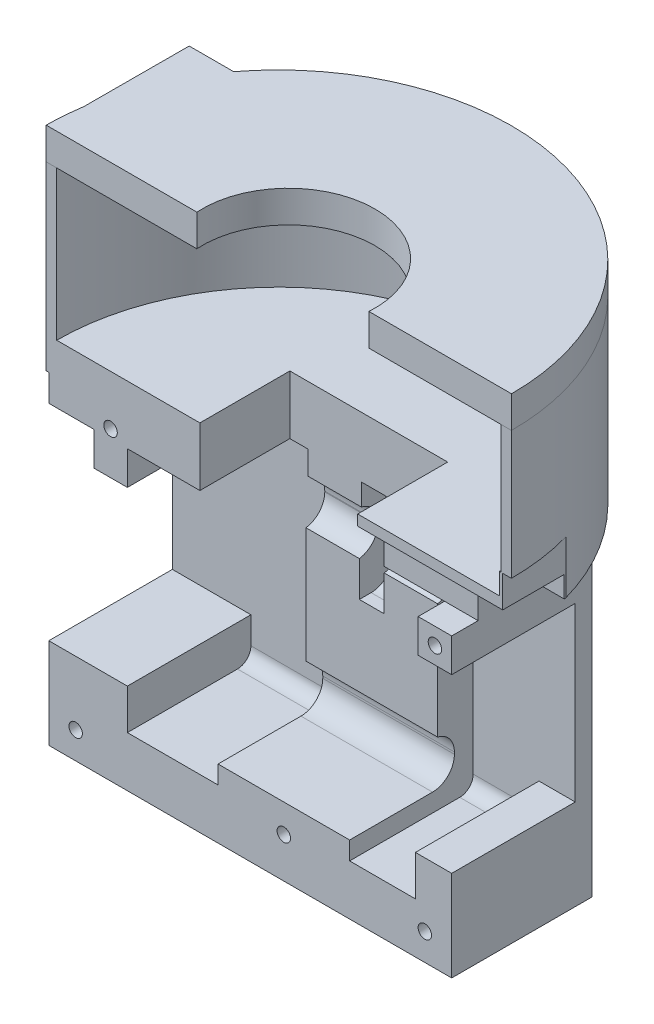
from build123d import *

# Parameters (mm, degrees)
BOSS_EXTRUDE4_START        = -101.558494002
BOSS_EXTRUDE4_OUTLINE_R    = 1.27
BOSS_EXTRUDE4_DEPTH        = 26.543
BOSS_EXTRUDE4_2_DEPTH      = 3.175
BOSS_EXTRUDE4_START_2      = -98.383494002
BOSS_EXTRUDE4_3_OUTLINE_W  = 4.699
BOSS_EXTRUDE4_3_OUTLINE_H  = 19.05
BOSS_EXTRUDE4_3_DEPTH      = 3.175
BOSS_EXTRUDE4_START_3      = -86.941966379
BOSS_EXTRUDE4_4_OUTLINE_W  = 27.430295146
BOSS_EXTRUDE4_4_OUTLINE_H  = 6
BOSS_EXTRUDE4_4_DEPTH      = 6.926472377
BOSS_EXTRUDE4_START_4      = -95.208494002
BOSS_EXTRUDE4_5_OUTLINE_W  = 29.845
BOSS_EXTRUDE4_5_OUTLINE_H  = 6
BOSS_EXTRUDE4_5_DEPTH      = 3.175
BOSS_EXTRUDE4_6_OUTLINE_W  = 4.699
BOSS_EXTRUDE4_6_OUTLINE_H  = 19.05
BOSS_EXTRUDE4_6_DEPTH      = 0.381
BOSS_EXTRUDE4_START_5      = -44.196
BOSS_EXTRUDE4_7_DEPTH      = 24.892
BOSS_EXTRUDE4_8_DEPTH      = 10.0965
BOSS_EXTRUDE4_START_6      = -29.4005
BOSS_EXTRUDE4_9_DEPTH      = 10.0965
BOSS_EXTRUDE4_START_7      = -62
BOSS_EXTRUDE4_10_OUTLINE_W = 5.08
BOSS_EXTRUDE4_10_OUTLINE_H = 3.175
BOSS_EXTRUDE4_10_DEPTH     = 56
BOSS_EXTRUDE4_START_8      = 61.1124
BOSS_EXTRUDE4_11_DEPTH     = 6
BOSS_EXTRUDE4_START_9      = 56.0324
BOSS_EXTRUDE4_12_OUTLINE_W = 29.845
BOSS_EXTRUDE4_12_OUTLINE_H = 3.175
BOSS_EXTRUDE4_12_DEPTH     = 5.08
BOSS_EXTRUDE4_START_10     = 55.687225257
BOSS_EXTRUDE4_13_OUTLINE_W = 24.892
BOSS_EXTRUDE4_13_OUTLINE_H = 3.175
BOSS_EXTRUDE4_13_DEPTH     = 1.422815543
BOSS_EXTRUDE5_DEPTH        = 4
INDENT2_START              = 61.1124
INDENT2_DEPTH              = 4
CUT_EXTRUDE1_DEPTH         = 5
BOSS_EXTRUDE6_DEPTH        = 21.543
SKETCH18_W                 = 6.35
SKETCH18_H                 = 6.35
BOSS_EXTRUDE7_DEPTH        = 5
SKETCH19_R                 = 1.27
CUT_EXTRUDE2_DEPTH         = 26.543
SKETCH20_R                 = 42
CUT_EXTRUDE3_DEPTH         = 4
BOSS_EXTRUDE9_DEPTH        = 5
BOSS_EXTRUDE10_DEPTH       = 24.225897016
BOSS_EXTRUDE10_START       = 95.499839318
BOSS_EXTRUDE10_2_OUTLINE_W = 91
BOSS_EXTRUDE10_2_OUTLINE_H = 47
BOSS_EXTRUDE10_2_DEPTH     = 1.500160682
BOSS_EXTRUDE11_DEPTH       = 6


with BuildPart() as part:
    # Boss-Extrude4: read off the stored shape, not the designer's step
    # Boss-Extrude4 outline → Boss-Extrude4 (new body)
    # profile 1 of 3: a face of its own
    with BuildSketch(Plane.XY.offset(BOSS_EXTRUDE4_START)):
        Polygon((0, 61.1124), (-17.78, 61.1124), (-17.78, 56.0324), (-6.35, 56.0324), (-6.35, 49.6824), (0, 49.6824), align=None)
        with Locations((-3.81, 58.5724)):
            Circle(BOSS_EXTRUDE4_OUTLINE_R, mode=Mode.SUBTRACT)
    # profile 2 of 3: a face of its own
    with BuildSketch(Plane.XY.offset(BOSS_EXTRUDE4_START)):
        Polygon((-47.625, 56.0324), (-47.625, 61.1124), (-47.625, 67.1124), (-76.2, 67.1124), (-76.2, 56.0324), (-67.691, 56.0324), (-67.691, 49.6824), (-61.341, 49.6824), (-61.341, 56.0324), align=None)
        with Locations((-64.516, 57.6834)):
            Circle(BOSS_EXTRUDE4_OUTLINE_R, mode=Mode.SUBTRACT)
    # profile 3 of 3: a face of its own
    with BuildSketch(Plane.XY.offset(BOSS_EXTRUDE4_START)):
        Polygon((0, 0), (0, 17.145), (-6.858, 17.145), (-6.858, 9.525), (-19.304, 9.525), (-19.304, 12.954), (-44.196, 12.954), (-44.196, 9.525), (-61.341, 9.525), (-61.341, 17.145), (-76.2, 17.145), (-76.2, 0), align=None)
        with Locations((-71.12, 5.08)):
            Circle(BOSS_EXTRUDE4_OUTLINE_R, mode=Mode.SUBTRACT)
        with Locations((-31.75, 7.62)):
            Circle(BOSS_EXTRUDE4_OUTLINE_R, mode=Mode.SUBTRACT)
        with Locations((-5.08, 5.08)):
            Circle(BOSS_EXTRUDE4_OUTLINE_R, mode=Mode.SUBTRACT)
    extrude(amount=BOSS_EXTRUDE4_DEPTH)

    # Boss-Extrude4 2 outline → Boss-Extrude4 2 (add)
    with BuildSketch(Plane.XY.offset(BOSS_EXTRUDE4_START)):
        Polygon((-47.625, 67.1124), (-47.625, 56.0324), (-61.341, 56.0324), (-61.341, 49.6824), (-67.691, 49.6824), (-67.691, 56.0324), (-76.2, 56.0324), (-76.2, 17.145), (-61.341, 17.145), (-61.341, 9.525), (-44.196, 9.525), (-44.196, 12.954), (-19.304, 12.954), (-19.304, 9.525), (-6.858, 9.525), (-6.858, 17.145), (0, 17.145), (0, 49.6824), (-6.35, 49.6824), (-6.35, 56.0324), (-17.78, 56.0324), (-17.78, 67.1124), align=None)
    extrude(amount=BOSS_EXTRUDE4_2_DEPTH)

    # Boss-Extrude4 3 outline → Boss-Extrude4 3 (add)
    with BuildSketch(Plane.XY.offset(BOSS_EXTRUDE4_START_2)):
        Polygon((-47.625, 67.1124), (-47.625, 56.0324), (-44.196, 56.0324), (-44.196, 12.954), (-19.304, 12.954), (-19.304, 56.0324), (-17.78, 56.0324), (-17.78, 67.1124), align=None)
        with Locations((-31.75, 46.162225257)):
            Rectangle(BOSS_EXTRUDE4_3_OUTLINE_W, BOSS_EXTRUDE4_3_OUTLINE_H, mode=Mode.SUBTRACT)
    extrude(amount=BOSS_EXTRUDE4_3_DEPTH)

    # Boss-Extrude4 4 outline → Boss-Extrude4 4 (add)
    with BuildSketch(Plane.XY.offset(BOSS_EXTRUDE4_START_3)):
        with Locations((-4.064852427, 64.1124)):
            Rectangle(BOSS_EXTRUDE4_4_OUTLINE_W, BOSS_EXTRUDE4_4_OUTLINE_H)
    extrude(amount=BOSS_EXTRUDE4_4_DEPTH)

    # Boss-Extrude4 5 outline → Boss-Extrude4 5 (add)
    with BuildSketch(Plane.XY.offset(BOSS_EXTRUDE4_START_4)):
        with Locations((-32.7025, 64.1124)):
            Rectangle(BOSS_EXTRUDE4_5_OUTLINE_W, BOSS_EXTRUDE4_5_OUTLINE_H)
    extrude(amount=BOSS_EXTRUDE4_5_DEPTH)

    # Boss-Extrude4 6 outline → Boss-Extrude4 6 (add)
    with BuildSketch(Plane.XY.offset(BOSS_EXTRUDE4_START_2)):
        with Locations((-31.75, 46.162225257)):
            Rectangle(BOSS_EXTRUDE4_6_OUTLINE_W, BOSS_EXTRUDE4_6_OUTLINE_H)
    extrude(amount=BOSS_EXTRUDE4_6_DEPTH)

    # Boss-Extrude4 7 outline → Boss-Extrude4 7 (add)
    with BuildSketch(Plane.YZ.offset(BOSS_EXTRUDE4_START_5)):
        with BuildLine():
            Line((55.687225257, -92.033494002), (55.687225257, -93.874994002))
            ThreePointArc((55.687225257, -93.874994002), (54.478308496, -96.793577242), (51.559725257, -98.002494002))
            Line((51.559725257, -98.002494002), (55.687225257, -98.002494002))
            Line((55.687225257, -98.002494002), (55.687225257, -95.208494002))
            Line((55.687225257, -95.208494002), (61.1124, -95.208494002))
            Line((61.1124, -95.208494002), (61.1124, -92.033494002))
            Line((61.1124, -92.033494002), (55.687225257, -92.033494002))
        make_face()
        with BuildLine():
            Line((12.954, -95.208494002), (36.637225257, -95.208494002))
            Line((36.637225257, -95.208494002), (36.637225257, -98.002494002))
            Line((36.637225257, -98.002494002), (40.764725257, -98.002494002))
            ThreePointArc((40.764725257, -98.002494002), (37.846142018, -96.793577242), (36.637225257, -93.874994002))
            Line((36.637225257, -93.874994002), (36.637225257, -91.652494002))
            Line((36.637225257, -91.652494002), (21.4884, -91.652494002))
            ThreePointArc((21.4884, -91.652494002), (20.032074207, -93.937871393), (17.472307372, -94.827494002))
            Line((17.472307372, -94.827494002), (17.0815, -94.827494002))
            ThreePointArc((17.0815, -94.827494002), (14.16291676, -93.618577241), (12.954, -90.699994002))
            Line((12.954, -90.699994002), (12.954, -95.208494002))
        make_face()
    extrude(amount=BOSS_EXTRUDE4_7_DEPTH)

    # Boss-Extrude4 8 outline → Boss-Extrude4 8 (add)
    with BuildSketch(Plane.YZ.offset(BOSS_EXTRUDE4_START_5)):
        with BuildLine():
            Line((55.687225257, -92.033494002), (51.5874, -92.033494002))
            ThreePointArc((51.5874, -92.033494002), (50.131074207, -94.318871393), (47.571307372, -95.208494002))
            Line((47.571307372, -95.208494002), (55.465878608, -95.208494002))
            ThreePointArc((55.465878608, -95.208494002), (55.631512592, -94.55086688), (55.687225257, -93.874994002))
            Line((55.687225257, -93.874994002), (55.687225257, -92.033494002))
        make_face()
        with BuildLine():
            Line((36.858571906, -95.208494002), (47.420143143, -95.208494002))
            ThreePointArc((47.420143143, -95.208494002), (44.711140559, -94.19508476), (43.3324, -91.652494002))
            Line((43.3324, -91.652494002), (36.637225257, -91.652494002))
            Line((36.637225257, -91.652494002), (36.637225257, -93.874994002))
            ThreePointArc((36.637225257, -93.874994002), (36.692937922, -94.55086688), (36.858571906, -95.208494002))
        make_face()
    extrude(amount=BOSS_EXTRUDE4_8_DEPTH)

    # Boss-Extrude4 9 outline → Boss-Extrude4 9 (add)
    with BuildSketch(Plane.YZ.offset(BOSS_EXTRUDE4_START_6)):
        with BuildLine():
            Line((55.687225257, -92.033494002), (51.5874, -92.033494002))
            ThreePointArc((51.5874, -92.033494002), (50.131074207, -94.318871393), (47.571307372, -95.208494002))
            Line((47.571307372, -95.208494002), (55.465878608, -95.208494002))
            ThreePointArc((55.465878608, -95.208494002), (55.631512592, -94.55086688), (55.687225257, -93.874994002))
            Line((55.687225257, -93.874994002), (55.687225257, -92.033494002))
        make_face()
        with BuildLine():
            Line((36.858571906, -95.208494002), (47.420143143, -95.208494002))
            ThreePointArc((47.420143143, -95.208494002), (44.711140559, -94.19508476), (43.3324, -91.652494002))
            Line((43.3324, -91.652494002), (36.637225257, -91.652494002))
            Line((36.637225257, -91.652494002), (36.637225257, -93.874994002))
            ThreePointArc((36.637225257, -93.874994002), (36.692937922, -94.55086688), (36.858571906, -95.208494002))
        make_face()
    extrude(amount=BOSS_EXTRUDE4_9_DEPTH)

    # Boss-Extrude4 10 outline → Boss-Extrude4 10 (add)
    with BuildSketch(Plane.YZ.offset(BOSS_EXTRUDE4_START_7)):
        with Locations((58.5724, -93.620994002)):
            Rectangle(BOSS_EXTRUDE4_10_OUTLINE_W, BOSS_EXTRUDE4_10_OUTLINE_H)
        with BuildLine():
            Line((9.525, -98.383494002), (12.065, -98.383494002))
            ThreePointArc((12.065, -98.383494002), (10.268948776, -97.639545226), (9.525, -95.843494002))
            Line((9.525, -95.843494002), (9.525, -98.383494002))
        make_face()
    extrude(amount=BOSS_EXTRUDE4_10_DEPTH)

    # Boss-Extrude4 11 outline → Boss-Extrude4 11 (add)
    with BuildSketch(Plane(origin=(0, 0, 0), x_dir=(1, 0, 0), z_dir=(0, 1, 0)).offset(BOSS_EXTRUDE4_START_8)):
        with BuildLine():
            ThreePointArc((-76.2, 81.646292879), (-76.576695149, 78.340400016), (-76.7025, 75.015494002))
            Line((-76.7025, 75.015494002), (-76.2, 75.015494002))
            Line((-76.2, 75.015494002), (-76.2, 81.646292879))
        make_face()
        with BuildLine():
            ThreePointArc((9.650295146, 86.941966379), (-24.542264928, 118.252174767), (-67.794794753, 101.558494002))
            Line((-67.794794753, 101.558494002), (-17.78, 101.558494002))
            Line((-17.78, 101.558494002), (-17.78, 86.941966379))
            Line((-17.78, 86.941966379), (9.650295146, 86.941966379))
        make_face()
    extrude(amount=BOSS_EXTRUDE4_11_DEPTH)

    # Boss-Extrude4 12 outline → Boss-Extrude4 12 (add)
    with BuildSketch(Plane(origin=(0, 0, 0), x_dir=(1, 0, 0), z_dir=(0, 1, 0)).offset(BOSS_EXTRUDE4_START_9)):
        with Locations((-32.7025, 93.620994002)):
            Rectangle(BOSS_EXTRUDE4_12_OUTLINE_W, BOSS_EXTRUDE4_12_OUTLINE_H)
    extrude(amount=BOSS_EXTRUDE4_12_DEPTH)

    # Boss-Extrude4 13 outline → Boss-Extrude4 13 (add)
    with BuildSketch(Plane(origin=(0, 0, 0), x_dir=(1, 0, 0), z_dir=(0, 1, 0)).offset(BOSS_EXTRUDE4_START_10)):
        with Locations((-31.75, 93.620994002)):
            Rectangle(BOSS_EXTRUDE4_13_OUTLINE_W, BOSS_EXTRUDE4_13_OUTLINE_H)
    extrude(amount=BOSS_EXTRUDE4_13_DEPTH)

    # Sketch11 → Boss-Extrude5 (add)
    with BuildSketch(Plane(origin=(0, 67.1124, 0), x_dir=(1, 0, 0), z_dir=(0, 1, 0))):
        with BuildLine():
            Line((-17.78, 80.015494002), (9.650295146, 80.015494002))
            Line((9.650295146, 80.015494002), (9.650295146, 86.941966379))
            ThreePointArc((9.650295146, 86.941966379), (-24.542264928, 118.252174767), (-67.794794753, 101.558494002))
            Line((-67.794794753, 101.558494002), (-76.2, 101.558494002))
            Line((-76.2, 101.558494002), (-76.2, 81.646292879))
            ThreePointArc((-76.2, 81.646292879), (-76.576695149, 78.340400016), (-76.7025, 75.015494002))
            Line((-76.7025, 75.015494002), (-47.625, 75.015494002))
            Line((-47.625, 75.015494002), (-47.625, 92.033494002))
            Line((-47.625, 92.033494002), (-17.78, 92.033494002))
            Line((-17.78, 92.033494002), (-17.78, 80.015494002))
        make_face()
    extrude(amount=BOSS_EXTRUDE5_DEPTH)

    # Indent2: read off the stored shape, not the designer's step
    # Indent2 outline → Indent2 (cut)
    with BuildSketch(Plane(origin=(0, 0, 0), x_dir=(1, 0, 0), z_dir=(0, 1, 0)).offset(INDENT2_START)):
        Polygon((-9.889050862, 86.629325085), (-17.78, 86.629325085), (-17.78, 80.015494002), (9.650295146, 80.015494002), (9.650295146, 86.629325085), (0.110949138, 86.629325085), (0.110949138, 90.629325085), (-9.889050862, 90.629325085), align=None)
    extrude(amount=INDENT2_DEPTH, mode=Mode.SUBTRACT)

    # Sketch16 → Cut-Extrude1 (cut)
    with BuildSketch(Plane.XY.offset(-75.015494002)):
        Polygon((0, 61.1124), (-17.78, 61.1124), (-17.78, 56.0324), (-6.35, 56.0324), (-6.35, 49.6824), (0, 49.6824), align=None)
    extrude(amount=-CUT_EXTRUDE1_DEPTH, mode=Mode.SUBTRACT)

    # Sketch17 → Boss-Extrude6 (add)
    with BuildSketch(Plane.XY.offset(-80.015494002)):
        Polygon((0, 49.6824), (0, 61.1124), (-17.78, 61.1124), (-17.78, 56.0324), (-6.35, 56.0324), (-6.35, 49.6824), align=None)
    extrude(amount=-BOSS_EXTRUDE6_DEPTH)

    # Sketch18 → Boss-Extrude7 (add)
    with BuildSketch(Plane.XY.offset(-80.015494002)):
        with Locations((-3.175, 52.8574)):
            Rectangle(SKETCH18_W, SKETCH18_H)
    extrude(amount=BOSS_EXTRUDE7_DEPTH)

    # Sketch19 → Cut-Extrude2 (cut)
    with BuildSketch(Plane.XY.offset(-75.015494002)):
        with Locations((-3.175, 52.8574)):
            Circle(SKETCH19_R)
    extrude(amount=-CUT_EXTRUDE2_DEPTH, mode=Mode.SUBTRACT)

    # Sketch20 → Cut-Extrude3 (cut)
    with BuildSketch(Plane(origin=(0, 71.1124, 0), x_dir=(1, 0, 0), z_dir=(0, 1, 0))):
        with Locations((-32.7025, 75.015494002)):
            Circle(SKETCH20_R)
    extrude(amount=-CUT_EXTRUDE3_DEPTH, mode=Mode.SUBTRACT)

    # Sketch23 → Boss-Extrude9 (add)
    with BuildSketch(Plane.XY.offset(-80.015494002)):
        Polygon((9.650295146, 71.1124), (8.998818924, 71.1124), (8.998818924, 67.1124), (-17.78, 67.1124), (-17.78, 65.1124), (9.650295146, 65.1124), align=None)
    extrude(amount=BOSS_EXTRUDE9_DEPTH)

    # Boss-Extrude10: read off the stored shape, not the designer's step
    # Boss-Extrude10 outline → Boss-Extrude10 (add)
    with BuildSketch(Plane(origin=(0, 71.1124, 0), x_dir=(1, 0, 0), z_dir=(0, 1, 0))):
        with BuildLine():
            ThreePointArc((-74.7025, 75.015494002), (-46.790110082, 114.582389788), (-0.153012277, 101.558494002))
            ThreePointArc((-0.153012277, 101.558494002), (6.864395786, 89.103104084), (9.2975, 75.015494002))
            Line((9.2975, 75.015494002), (11.2975, 75.015494002))
            ThreePointArc((11.2975, 75.015494002), (-18.703588777, 116.729166635), (-67.794794753, 101.558494002))
            Line((-67.794794753, 101.558494002), (-76.2, 101.558494002))
            Line((-76.2, 101.558494002), (-76.2, 81.646292879))
            ThreePointArc((-76.2, 81.646292879), (-76.576695149, 78.340400016), (-76.7025, 75.015494002))
            Line((-76.7025, 75.015494002), (-74.7025, 75.015494002))
        make_face()
    extrude(amount=BOSS_EXTRUDE10_DEPTH)

    # Boss-Extrude10 2 outline → Boss-Extrude10 2 (cut)
    with BuildSketch(Plane(origin=(0, 0, 0), x_dir=(1, 0, 0), z_dir=(0, 0.9999976749508124, -0.0021564074219559007)).offset(BOSS_EXTRUDE10_START)):
        with Locations((-32.5, 96.5)):
            Rectangle(BOSS_EXTRUDE10_2_OUTLINE_W, BOSS_EXTRUDE10_2_OUTLINE_H)
    extrude(amount=BOSS_EXTRUDE10_2_DEPTH, mode=Mode.SUBTRACT)

    # Sketch26 → Boss-Extrude11 (add)
    with BuildSketch(Plane(origin=(0, 95.499617276, -0.205936562), x_dir=(1, 0, 0), z_dir=(0, 0.9999976749508124, -0.002156407421956261))):
        with BuildLine():
            Line((11.2975, 74.809731376), (-15.671546302, 74.809731376))
            ThreePointArc((-15.671546302, 74.809731376), (-31.94102841, 92.21425616), (-48.210510518, 74.809731376))
            Line((-48.210510518, 74.809731376), (-76.7025, 74.809731376))
            add(Edge.make_bspline(
                [(-76.2, 81.44054567), (-76.7025, 78.144178977), (-76.7025, 74.809731376)],
                knots=[1.419520031, 1.419520031, 1.419520031, 1.570796327, 1.570796327, 1.570796327], degree=2, weights=[1, 0.997140799, 1]))
            Line((-76.2, 81.44054567), (-76.2, 101.35279309))
            Line((-76.2, 101.35279309), (-67.794794753, 101.35279309))
            add(Edge.make_bspline(
                [(11.2975, 74.809731376), (11.2975, 205.920346621), (-67.794794753, 101.35279309)],
                knots=[4.71238898, 4.71238898, 4.71238898, 7.206411806, 7.206411806, 7.206411806], degree=2, weights=[1, 0.318157073, 1]))
        make_face()
    extrude(amount=BOSS_EXTRUDE11_DEPTH)


solid = part.part
